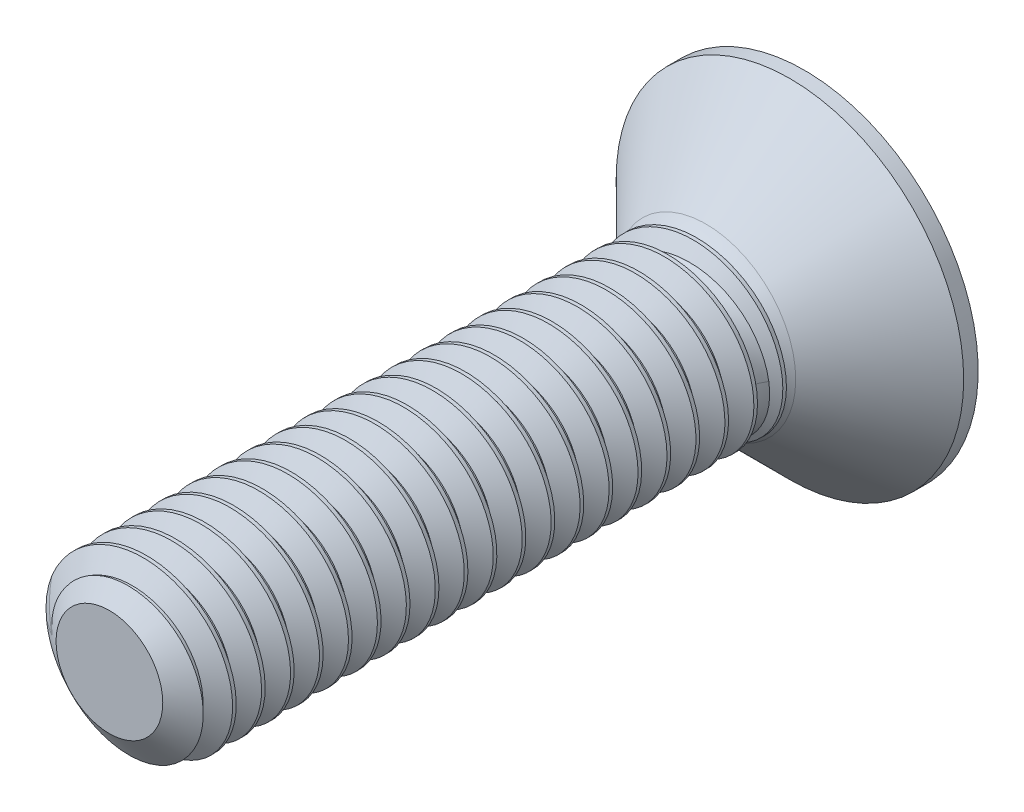
from build123d import *

# Parameters (mm, degrees)
SKETCH1_R          = 1.5
EXTRUDE1_DEPTH     = 12
CUT_SWEEP1_PITCH   = 0.5
SKETCH6_R          = 3
EXTRUDE2_DEPTH     = 1.7
CUT_EXTRUDE1_DEPTH = 1.5
SKETCH8_R          = 1.154700538
CUT_EXTRUDE2_DEPTH = 13.727922156
CUT_EXTRUDE2_TAPER = 45


with BuildPart() as part:
    # Sketch1 → Extrude1 (new body)
    with BuildSketch(Plane.XY):
        Circle(SKETCH1_R)
    extrude(amount=-EXTRUDE1_DEPTH)

    # Cut-Sweep1: the profile of Sketch3 profile screwed along a right-hand helix of 25 turns, 6 arcs to a turn; built about Z, then put on its axis
    cut_sweep1_z = Axis((0, 0, 0), (0, 0, 1))
    cut_sweep1_corners = [(1.5003, 0, -0.437673205), (1.175240474, 0, -0.25), (1.175240474, 0, -0.1875), (1.5003, 0, 0.000173205)]
    with BuildLine(mode=Mode.PRIVATE) as cut_sweep1_profile:
        Line(cut_sweep1_corners[0], cut_sweep1_corners[1])
        Line(cut_sweep1_corners[1], cut_sweep1_corners[2])
        Line(cut_sweep1_corners[2], cut_sweep1_corners[3])
        Line(cut_sweep1_corners[3], cut_sweep1_corners[0])
    cut_sweep1_cap = Face(cut_sweep1_profile.wire())
    cut_sweep1_turn_angles = [0, 30, 60, 90, 120, 150, 180, 210, 240, 270, 300, 330, 360]
    cut_sweep1_turn_weights = [1, 0.8660254037844387, 1, 0.8660254037844387, 1, 0.8660254037844387, 1, 0.8660254037844387, 1, 0.8660254037844387, 1, 0.8660254037844387, 1]
    cut_sweep1_turn_rails = [Edge.make_bspline([Vector(p[0], p[1], 0).rotate(cut_sweep1_z, cut_sweep1_turn_angles[k]) / cut_sweep1_turn_weights[k] + Vector(0, 0, p[2] + CUT_SWEEP1_PITCH * cut_sweep1_turn_angles[k] / 360) for k in range(13)], [0, 0, 0, 1, 1, 2, 2, 3, 3, 4, 4, 5, 5, 6, 6, 6], 2, cut_sweep1_turn_weights) for p in cut_sweep1_corners]
    cut_sweep1_turn_sides = [Face.make_surface_from_curves(cut_sweep1_turn_rails[p[0]], cut_sweep1_turn_rails[p[1]]) for p in [(0, 1), (1, 2), (2, 3), (3, 0)]]
    cut_sweep1 = Plane(origin=(0, 0, 0), x_dir=(0, 1, 0), z_dir=(0, 0, -1)) * Solid(Shell([*[p.moved(Location((0, 0, CUT_SWEEP1_PITCH * i))) for i in range(25) for p in cut_sweep1_turn_sides], cut_sweep1_cap, cut_sweep1_cap.rotate(cut_sweep1_z, 9000).moved(Location((0, 0, CUT_SWEEP1_PITCH * 9000 / 360)))]))
    add(cut_sweep1, mode=Mode.SUBTRACT)

    # Sketch4 → Cut-Revolve1 (revolve, cut)
    with BuildSketch(Plane(origin=(0, 0, 0), x_dir=(0, 0, -1), z_dir=(1, 0, 0)), mode=Mode.PRIVATE) as cut_revolve1_sk:
        Polygon((0.405251783, 1.5), (0, 0.921240474), (0, 1.5), align=None)
    revolve(cut_revolve1_sk.sketch.rotate(Axis((0, 0, 0), (0, 0, -1)), 263.352109169), axis=Axis((0, 0, 0), (0, 0, -1)), mode=Mode.SUBTRACT)

    # Sketch6 → Extrude2 (add)
    with BuildSketch(Plane(origin=(0, 0, -12), x_dir=(-1, 0, 0), z_dir=(0, 0, -1))):
        Circle(SKETCH6_R)
    extrude(amount=-EXTRUDE2_DEPTH)

    # Sketch10 → Cut-Revolve2 (revolve, cut)
    with BuildSketch(Plane(origin=(0, 0, 0), x_dir=(0, 0, -1), z_dir=(1, 0, 0)), mode=Mode.PRIVATE) as cut_revolve2_sk:
        Polygon((11.75, -3), (10.3, -1.55), (10.3, -3), align=None)
    revolve(cut_revolve2_sk.sketch.rotate(Axis((0, 0, 0), (0, 0, -1)), 270), axis=Axis((0, 0, 0), (0, 0, -1)), mode=Mode.SUBTRACT)

    # Sketch11 → Revolve1 (revolve)
    with BuildSketch(Plane(origin=(0, 0, 0), x_dir=(0, 0, -1), z_dir=(1, 0, 0)), mode=Mode.PRIVATE) as revolve1_sk:
        with BuildLine():
            Line((9.395250469, 1.175240474), (9.395250469, 0))
            Line((9.395250469, 0), (10.3, 0))
            Line((10.3, 0), (10.3, 1.55))
            ThreePointArc((10.3, 1.55), (9.884897387, 1.272637301), (9.395250469, 1.175240474))
        make_face()
    revolve(revolve1_sk.sketch.rotate(Axis((0, 0, 0), (0, 0, -1)), 90), axis=Axis((0, 0, 0), (0, 0, -1)))

    # Sketch7 → Cut-Extrude1 (cut)
    with BuildSketch(Plane.XY.offset(-12)):
        Polygon((0, 1.154700538), (-1, 0.577350269), (-1, -0.577350269), (0, -1.154700538), (1, -0.577350269), (1, 0.577350269), align=None)
    extrude(amount=CUT_EXTRUDE1_DEPTH, mode=Mode.SUBTRACT)

    # Sketch8 → Cut-Extrude2 (cut, through all)
    with BuildSketch(Plane.XY.offset(-12)):
        Circle(SKETCH8_R)
    extrude(amount=CUT_EXTRUDE2_DEPTH, taper=CUT_EXTRUDE2_TAPER, mode=Mode.SUBTRACT)


solid = part.part
